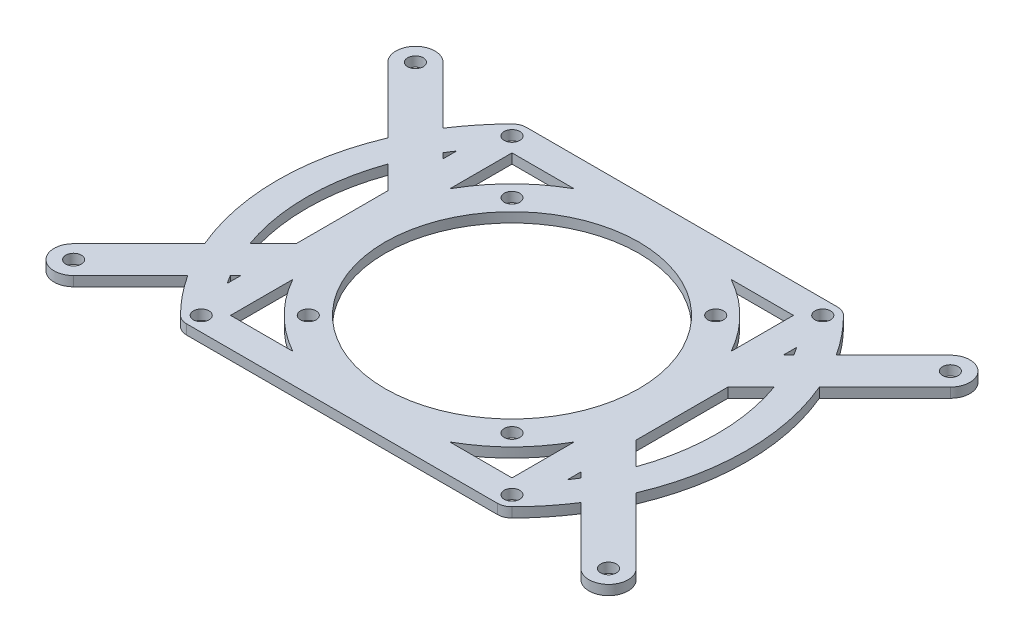
from build123d import *

# Parameters (mm, degrees)
SKETCH1_R           = 1.6
BOSS_EXTRUDE1_DEPTH = 2
SKETCH2_R           = 48
SKETCH2_R_2         = 42
SKETCH2_R_3         = 1.6
BOSS_EXTRUDE2_DEPTH = 2
SKETCH3_R           = 1.6
BOSS_EXTRUDE3_DEPTH = 2
CUT_EXTRUDE1_DEPTH  = 10
FILLET1_R           = 3
BOSS_EXTRUDE4_DEPTH = 2
CUT_EXTRUDE2_START  = -10
SKETCH6_R           = 26
CUT_EXTRUDE2_DEPTH  = 10


with BuildPart() as part:
    # Sketch1 → Boss-Extrude1 (new body)
    with BuildSketch(Plane(origin=(0, 0, 0), x_dir=(1, 0, 0), z_dir=(0, 1, 0))):
        with BuildLine():
            Line((-51.943772875, 37.828427125), (-29.299283734, 15.183937983))
            ThreePointArc((-29.299283734, 15.183937983), (0, 33), (29.299283734, 15.183937983))
            Line((29.299283734, 15.183937983), (51.943772875, 37.828427125))
            ThreePointArc((51.943772875, 37.828427125), (57.600627125, 37.828427125), (57.600627125, 32.171572875))
            Line((57.600627125, 32.171572875), (32.280845123, 6.851790873))
            ThreePointArc((32.280845123, 6.851790873), (33, 0), (32.280845123, -6.851790873))
            Line((32.280845123, -6.851790873), (57.600627125, -32.171572875))
            ThreePointArc((57.600627125, -32.171572875), (57.600627125, -37.828427125), (51.943772875, -37.828427125))
            Line((51.943772875, -37.828427125), (29.299283734, -15.183937983))
            ThreePointArc((29.299283734, -15.183937983), (0, -33), (-29.299283734, -15.183937983))
            Line((-29.299283734, -15.183937983), (-51.943772875, -37.828427125))
            ThreePointArc((-51.943772875, -37.828427125), (-57.600627125, -37.828427125), (-57.600627125, -32.171572875))
            Line((-57.600627125, -32.171572875), (-32.280845123, -6.851790873))
            ThreePointArc((-32.280845123, -6.851790873), (-33, 0), (-32.280845123, 6.851790873))
            Line((-32.280845123, 6.851790873), (-57.600627125, 32.171572875))
            ThreePointArc((-57.600627125, 32.171572875), (-57.600627125, 37.828427125), (-51.943772875, 37.828427125))
        make_face()
        with Locations(Location((54.7722, 35, 0), (0, 0, 270))):
            Circle(SKETCH1_R, mode=Mode.SUBTRACT)
        with Locations(Location((-54.7722, 35, 0), (0, 0, 90))):
            Circle(SKETCH1_R, mode=Mode.SUBTRACT)
        with Locations(Location((54.7722, -35, 0), (0, 0, 90))):
            Circle(SKETCH1_R, mode=Mode.SUBTRACT)
        with Locations(Location((-54.7722, -35, 0), (0, 0, 270))):
            Circle(SKETCH1_R, mode=Mode.SUBTRACT)
        with Locations(Location((20.859650045, 20.859650045, 0), (0, 0, 270))):
            Circle(SKETCH1_R, mode=Mode.SUBTRACT)
        with Locations(Location((-20.859650045, 20.859650045, 0), (0, 0, 90))):
            Circle(SKETCH1_R, mode=Mode.SUBTRACT)
        with Locations(Location((20.859650045, -20.859650045, 0), (0, 0, 90))):
            Circle(SKETCH1_R, mode=Mode.SUBTRACT)
        with Locations(Location((-20.859650045, -20.859650045, 0), (0, 0, 270))):
            Circle(SKETCH1_R, mode=Mode.SUBTRACT)
        with BuildLine():
            Line((0, 4.242640687), (-16.140662024, 20.383302711))
            ThreePointArc((-16.140662024, 20.383302711), (0, 26), (16.140662024, 20.383302711))
            Line((16.140662024, 20.383302711), (0, 4.242640687))
        make_face(mode=Mode.SUBTRACT)
        with BuildLine():
            Line((0, -4.242640687), (-16.140662024, -20.383302711))
            ThreePointArc((-16.140662024, -20.383302711), (0, -26), (16.140662024, -20.383302711))
            Line((16.140662024, -20.383302711), (0, -4.242640687))
        make_face(mode=Mode.SUBTRACT)
        with BuildLine():
            Line((4.242640687, 0), (20.383302711, -16.140662024))
            ThreePointArc((20.383302711, -16.140662024), (26, 0), (20.383302711, 16.140662024))
            Line((20.383302711, 16.140662024), (4.242640687, 0))
        make_face(mode=Mode.SUBTRACT)
        with BuildLine():
            Line((-4.242640687, 0), (-20.383302711, -16.140662024))
            ThreePointArc((-20.383302711, -16.140662024), (-26, 0), (-20.383302711, 16.140662024))
            Line((-20.383302711, 16.140662024), (-4.242640687, 0))
        make_face(mode=Mode.SUBTRACT)
    extrude(amount=BOSS_EXTRUDE1_DEPTH)

    # Sketch2 → Boss-Extrude2 (add)
    with BuildSketch(Plane(origin=(0, 2, 0), x_dir=(1, 0, 0), z_dir=(0, 1, 0))):
        Circle(SKETCH2_R)
        Circle(SKETCH2_R_2, mode=Mode.SUBTRACT)
        with Locations(Location((31.819805153, 31.819805153, 0), (0, 0, 270))):
            Circle(SKETCH2_R_3, mode=Mode.SUBTRACT)
        with Locations(Location((-31.819805153, 31.819805153, 0), (0, 0, 270))):
            Circle(SKETCH2_R_3, mode=Mode.SUBTRACT)
        with Locations(Location((31.819805153, -31.819805153, 0), (0, 0, 270))):
            Circle(SKETCH2_R_3, mode=Mode.SUBTRACT)
        with Locations(Location((-31.819805153, -31.819805153, 0), (0, 0, 270))):
            Circle(SKETCH2_R_3, mode=Mode.SUBTRACT)
    extrude(amount=-BOSS_EXTRUDE2_DEPTH)

    # Sketch3 → Boss-Extrude3 (add)
    # profile 1 of 2: a face of its own
    with BuildSketch(Plane(origin=(0, 2, 0), x_dir=(1, 0, 0), z_dir=(0, 1, 0))):
        with BuildLine():
            Line((34.819811892, 31.819805153), (34.819811892, -31.819805153))
            ThreePointArc((34.819811892, -31.819805153), (31.819805153, -34.819811892), (28.819798415, -31.819805153))
            Line((28.819798415, -31.819805153), (28.819798415, 31.819805153))
            ThreePointArc((28.819798415, 31.819805153), (31.819805153, 34.819811892), (34.819811892, 31.819805153))
        make_face()
        with Locations(Location((31.819805153, -31.819805153, 0), (0, 0, 270))):
            Circle(SKETCH3_R, mode=Mode.SUBTRACT)
        with Locations(Location((31.819805153, 31.819805153, 0), (0, 0, 270))):
            Circle(SKETCH3_R, mode=Mode.SUBTRACT)
    # profile 2 of 2: a face of its own
    with BuildSketch(Plane(origin=(0, 2, 0), x_dir=(1, 0, 0), z_dir=(0, 1, 0))):
        with BuildLine():
            Line((-28.819798415, -31.819805153), (-28.819798415, 31.819805153))
            ThreePointArc((-28.819798415, 31.819805153), (-31.819805153, 34.819811892), (-34.819811892, 31.819805153))
            Line((-34.819811892, 31.819805153), (-34.819811892, -31.819805153))
            ThreePointArc((-34.819811892, -31.819805153), (-31.819805153, -34.819811892), (-28.819798415, -31.819805153))
        make_face()
        with Locations(Location((-31.819805153, 31.819805153, 0), (0, 0, 270))):
            Circle(SKETCH3_R, mode=Mode.SUBTRACT)
        with Locations(Location((-31.819805153, -31.819805153, 0), (0, 0, 270))):
            Circle(SKETCH3_R, mode=Mode.SUBTRACT)
    extrude(amount=-BOSS_EXTRUDE3_DEPTH)

    # Sketch4 → Cut-Extrude1 (cut)
    with BuildSketch(Plane(origin=(0, 2, 0), x_dir=(1, 0, 0), z_dir=(0, 1, 0))):
        Polygon((-28.819805153, 31.819805153), (-28.819805153, 24.740165209), (0, 38.846192425), (28.819805153, 24.740165209), (28.819805153, 31.819805153), (28.819805153, 53.488724091), (-28.819805153, 53.488724091), align=None)
        Polygon((28.819805153, -31.819805153), (28.819805153, -27.443703625), (0, -37.592318486), (-28.819805153, -27.443703625), (-28.819805153, -31.819805153), (-28.819805153, -57.678243433), (28.819805153, -57.678243433), align=None)
    extrude(amount=-CUT_EXTRUDE1_DEPTH, mode=Mode.SUBTRACT)

    # Fillet1
    # the kernel refuses this fillet: 3 mm, written as the material it takes off along each edge
    with BuildSketch(Plane(origin=(-28.819805153, -16.95161691, -38.385138152), x_dir=(0, 0, 1), z_dir=(0, 1, 0)), Plane(origin=(28.819805153, -16.95161691, 38.385138152), x_dir=(0, 0, -1), z_dir=(0, 1, 0))) as fillet1_piece_1:
        with BuildLine():
            CenterArc((6.565332998, -3), FILLET1_R, 90, 135)
            ThreePointArc((4.444012655, -5.121320344), (2.131461319, -2.639230371), (0, 0))
            Line((0, 0), (6.565332998, 0))
        make_face()
    extrude(amount=35.903233819, mode=Mode.SUBTRACT)
    with BuildSketch(Plane(origin=(-28.819805153, -16.95161691, 38.385138152), x_dir=(-0.755284934005079, 0, -0.6553965734308833), z_dir=(0, 1, 0)), Plane(origin=(28.819805153, -16.95161691, -38.385138152), x_dir=(0.7552849340050823, 0, 0.6553965734308795), z_dir=(0, 1, 0))) as fillet1_piece_2:
        with BuildLine():
            CenterArc((6.568751552, -2.99250738), FILLET1_R, 85.949727095, 135)
            Line((4.30289675, -4.9586971), (0, 0))
            ThreePointArc((0, 0), (3.390323382, 0.11988192), (6.780646764, 0))
        make_face()
    extrude(amount=35.903233819, mode=Mode.SUBTRACT)


with BuildPart() as boss_extrude4_tool:
    # Sketch5 → Boss-Extrude4 (new body)
    with BuildSketch(Plane(origin=(0, 2, 0), x_dir=(1, 0, 0), z_dir=(0, 1, 0))):
        Polygon((-31.819798415, 34.819811892), (31.819798415, 34.819811892), (29.753362448, 32.753375926), (28.819798415, 31.819811892), (28.819798415, 28.819811892), (0, 28.819811892), (-28.819798415, 28.819811892), (-28.819798415, 31.819811892), align=None)
        Polygon((-28.819798415, -31.819811892), (-31.819798415, -34.819811892), (31.819798415, -34.819811892), (29.753362448, -32.753375926), (28.819798415, -31.819811892), (28.819798415, -28.819811892), (0, -28.819811892), (-28.819798415, -28.819811892), align=None)
    extrude(amount=-BOSS_EXTRUDE4_DEPTH)


with BuildPart() as part_1:
    add(part.part)


with BuildPart() as part_2:
    # Boss-Extrude4: joined with boss_extrude4_tool
    add(part_1.part.fuse(boss_extrude4_tool.part, tol=0.00001))

    # Sketch6 → Cut-Extrude2 (cut)
    with BuildSketch(Plane(origin=(0, 2, 0), x_dir=(1, 0, 0), z_dir=(0, 1, 0)).offset(CUT_EXTRUDE2_START)):
        with Locations(Location((0, 0, 0), (0, 0, 270))):
            Circle(SKETCH6_R)
    extrude(amount=CUT_EXTRUDE2_DEPTH, mode=Mode.SUBTRACT)


solid = part_2.part
